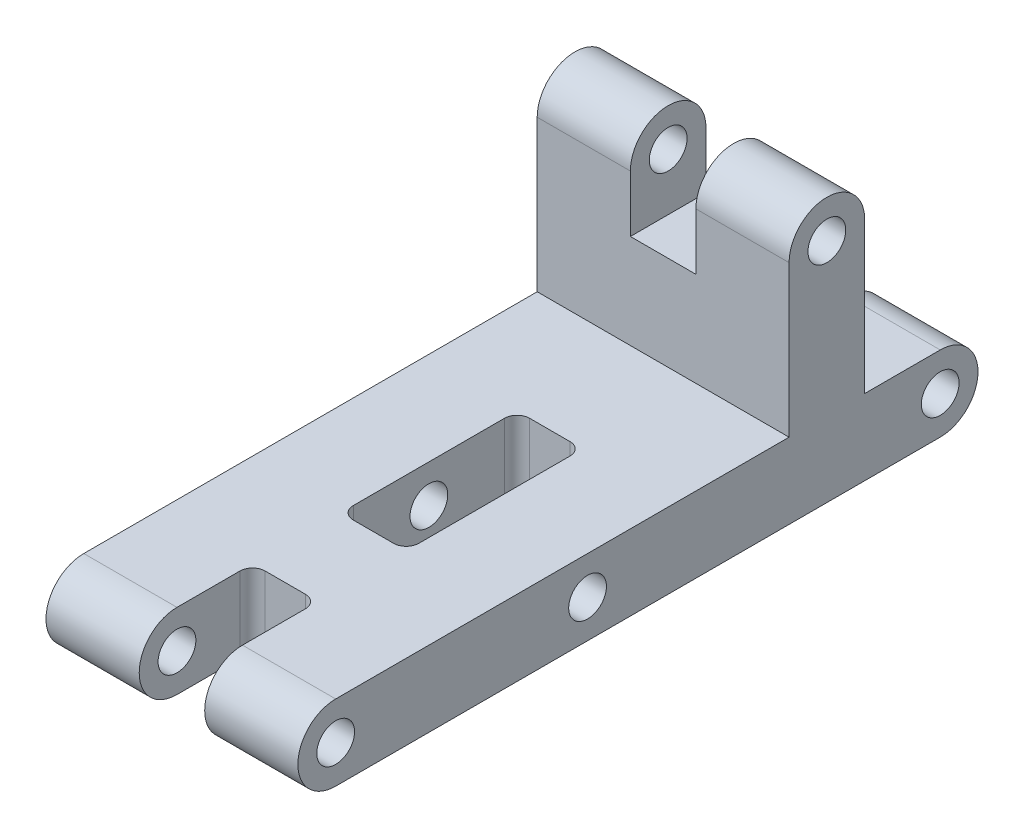
from build123d import *

# Parameters (mm, degrees)
CROQUIS1_R              = 1.5
SALIENTE_EXTRUIR1_DEPTH = 10
CROQUIS2_W              = 6
CROQUIS2_H              = 7.5
CROQUIS2_W_2            = 14
CROQUIS2_H_2            = 6
CROQUIS2_W_3            = 9
CORTAR_EXTRUIR1_DEPTH   = 2.6
REDONDEO1_R             = 1


with BuildPart() as part:
    # Croquis1 → Saliente-Extruir1 (new, symmetric)
    with BuildSketch(Plane(origin=(0, 0, 0), x_dir=(0, 0, -1), z_dir=(1, 0, 0))):
        with BuildLine():
            Line((-14, 3), (2, 3))
            Line((2, 3), (2, 15))
            ThreePointArc((2, 15), (5, 18), (8, 15))
            Line((8, 15), (8, 3))
            Line((8, 3), (14, 3))
            ThreePointArc((14, 3), (17, 0), (14, -3))
            Line((14, -3), (-14, -3))
            Line((-14, -3), (-34, -3))
            ThreePointArc((-34, -3), (-37, 0), (-34, 3))
            Line((-34, 3), (-14, 3))
        make_face()
        with Locations((14, 0)):
            Circle(CROQUIS1_R, mode=Mode.SUBTRACT)
        with Locations((5, 15)):
            Circle(CROQUIS1_R, mode=Mode.SUBTRACT)
        with Locations((-14, 0)):
            Circle(CROQUIS1_R, mode=Mode.SUBTRACT)
        with Locations((-34, 0)):
            Circle(CROQUIS1_R, mode=Mode.SUBTRACT)
    extrude(amount=SALIENTE_EXTRUIR1_DEPTH, both=True)

    # Croquis2 → Cortar-Extruir1 (cut, symmetric)
    with BuildSketch(Plane(origin=(0, 0, 0), x_dir=(0, 0, -1), z_dir=(1, 0, 0))):
        with Locations((5, 14.25)):
            Rectangle(CROQUIS2_W, CROQUIS2_H)
        with Locations((-14, 0)):
            Rectangle(CROQUIS2_W_2, CROQUIS2_H_2)
        with Locations((12.5, 0)):
            Rectangle(CROQUIS2_W_3, CROQUIS2_H_2)
        with Locations((-32.5, 0)):
            Rectangle(CROQUIS2_W_3, CROQUIS2_H_2)
    extrude(amount=CORTAR_EXTRUIR1_DEPTH, both=True, mode=Mode.SUBTRACT)

    # Redondeo1
    redondeo1_edges = [part.edges().sort_by_distance(p)[0] for p in [
        (2.6, 0, 7),
        (2.6, 0, 21),
        (-2.6, 0, 7),
        (-2.6, 0, 21),
        (2.6, 0, 28),
        (-2.6, 0, 28),
        (2.6, 0, -8),
        (-2.6, 0, -8),
    ]]
    fillet(redondeo1_edges, radius=REDONDEO1_R)


solid = part.part
